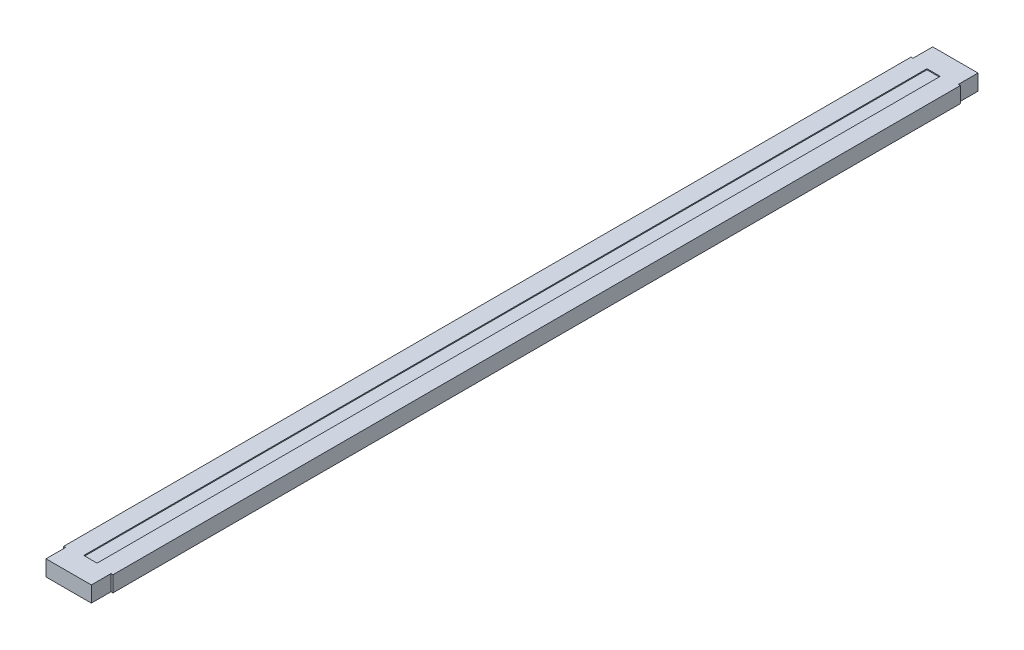
from build123d import *

# Parameters (mm, degrees)
SKETCH1_W               = 12.7
SKETCH1_H               = 4.064
BOSS_EXTRUDE1_DEPTH     = 228.6
SKETCH2_W               = 3.429
SKETCH2_H               = 217.3732
CUT_EXTRUDE1_DEPTH      = 0.254
SKETCH3_W               = 0.508
SKETCH3_H               = 5.08
CUT_EXTRUDE2_DEPTH      = 229.724285103
MIRROR2_COPY_1_SKETCH_W = 0.508
MIRROR2_COPY_1_SKETCH_H = 5.08
MIRROR2_COPY_1_DEPTH    = 229.724285103


with BuildPart() as part:
    # Sketch1 → Boss-Extrude1 (new body)
    with BuildSketch(Plane.XY):
        Rectangle(SKETCH1_W, SKETCH1_H)
    extrude(amount=BOSS_EXTRUDE1_DEPTH)

    # Sketch2 → Cut-Extrude1 (cut)
    with BuildSketch(Plane(origin=(0, 2.032, 0), x_dir=(1, 0, 0), z_dir=(0, 1, 0))):
        with Locations((0, -114.3)):
            Rectangle(SKETCH2_W, SKETCH2_H)
    extrude(amount=-CUT_EXTRUDE1_DEPTH, mode=Mode.SUBTRACT)

    # Sketch3 → Cut-Extrude2 (cut, through all)
    with BuildSketch(Plane(origin=(0, 2.032, 0), x_dir=(1, 0, 0), z_dir=(0, 1, 0))):
        with Locations((-6.096, -226.06)):
            Rectangle(SKETCH3_W, SKETCH3_H)
    cut_extrude2 = extrude(amount=-CUT_EXTRUDE2_DEPTH, mode=Mode.SUBTRACT)

    # Mirror1: Cut-Extrude2 across plane
    add(cut_extrude2.mirror(Plane(origin=(0, 0, 114.3), x_dir=(1, 0, 0), z_dir=(0, 0, -1))), mode=Mode.SUBTRACT)

    # Mirror2: Cut-Extrude2 across plane
    add(cut_extrude2.mirror(Plane(origin=(0, 0, 0), x_dir=(0, 0, 1), z_dir=(1, 0, 0))), mode=Mode.SUBTRACT)

    # Mirror2 copy 1 sketch → Mirror2 copy 1 (cut, through all)
    with BuildSketch(Plane(origin=(0, 2.032, 228.6), x_dir=(-1, 0, 0), z_dir=(0, 1, 0))):
        with Locations((-6.096, -226.06)):
            Rectangle(MIRROR2_COPY_1_SKETCH_W, MIRROR2_COPY_1_SKETCH_H)
    extrude(amount=-MIRROR2_COPY_1_DEPTH, mode=Mode.SUBTRACT)


solid = part.part
